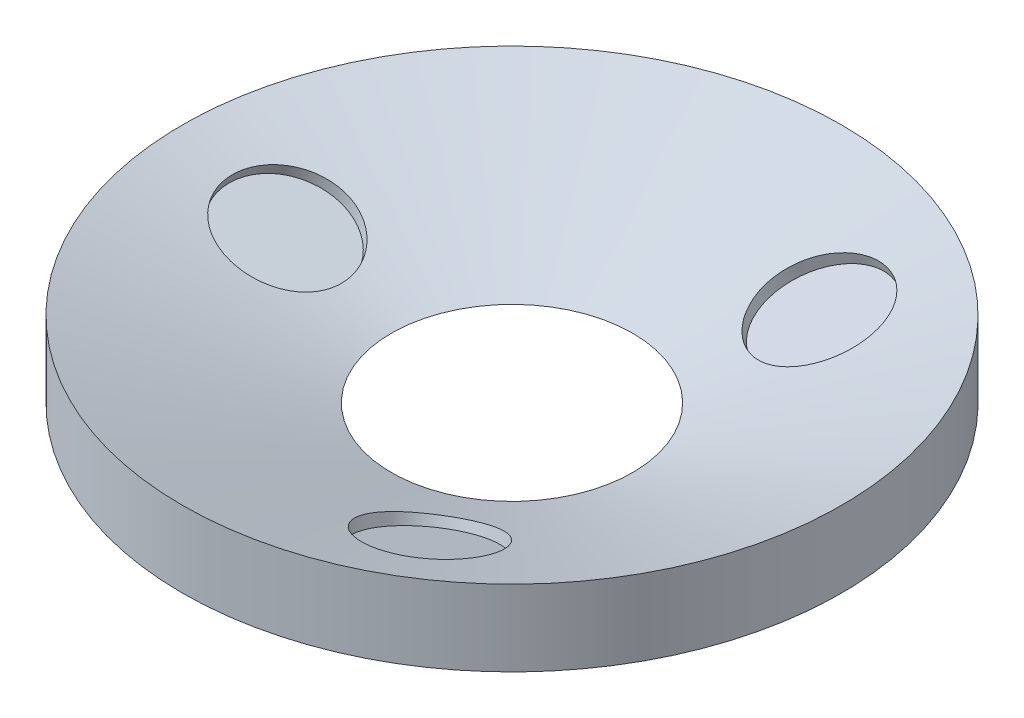
from build123d import *

# Parameters (mm, degrees)
TAGLIO_ESTRUSIONE5_START    = -2
SCHIZZO2_R                  = 12.5
TAGLIO_ESTRUSIONE5_DEPTH    = 12
RIPETIZIONECIRCOLARE1_COUNT = 3


with BuildPart() as part:
    # Schizzo1 → Rivoluzione1 (revolve)
    with BuildSketch(Plane.XY):
        Polygon((-71, 16.378660542), (-71, 0), (-26, 0), align=None)
    revolve(axis=Axis((0, 0, 0), (0, 1, 0)))

    # Schizzo2 → Taglio-Estrusione5 (cut)
    with BuildSketch(Plane(origin=(-3.041422239, -8.356238926, 6.31e-07), x_dir=(-0.9396926207859105, 0.342020143325663, 0), z_dir=(0.3420201433256621, 0.9396926207859081, -7.092250003537054e-08)).offset(TAGLIO_ESTRUSIONE5_START)):
        with Locations((48.376008021, 0)):
            Circle(SCHIZZO2_R)
    taglio_estrusione5 = extrude(amount=TAGLIO_ESTRUSIONE5_DEPTH, mode=Mode.SUBTRACT)

    # RipetizioneCircolare1: Taglio-Estrusione5 ×3 about axis
    ripetizionecircolare1_axis = Axis((0, 16.378660542, 0), (0, -1, 0))
    for i in range(1, RIPETIZIONECIRCOLARE1_COUNT):
        add(taglio_estrusione5.rotate(ripetizionecircolare1_axis, i * 360 / RIPETIZIONECIRCOLARE1_COUNT), mode=Mode.SUBTRACT)


solid = part.part
